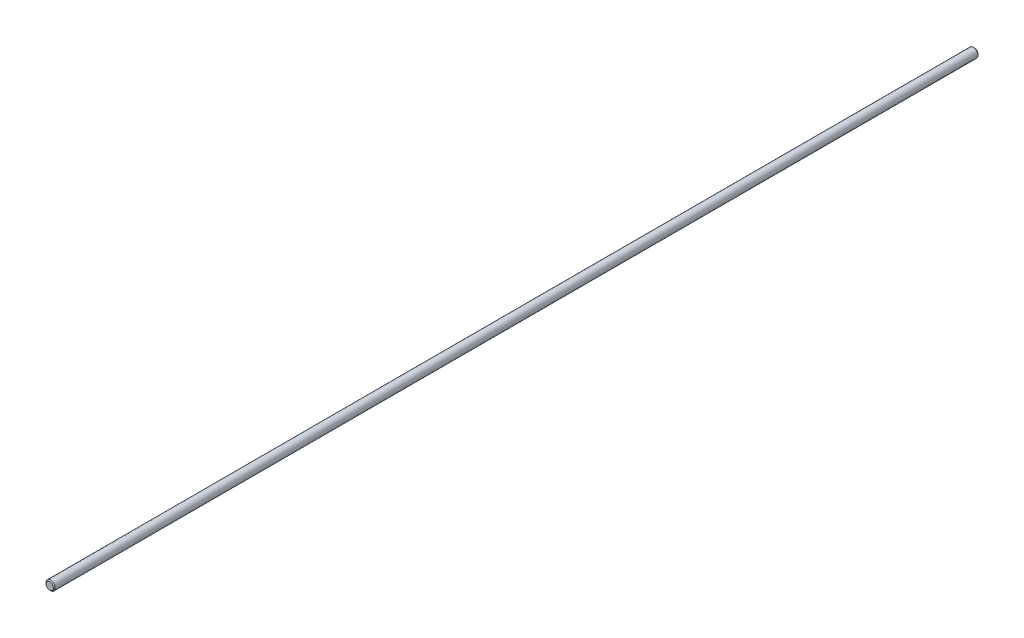
from build123d import *

# Parameters (mm, degrees)
SKETCH1_R           = 2.495
BOSS_EXTRUDE1_DEPTH = 500
CHAMFER1_SIZE       = 0.5


with BuildPart() as part:
    # Sketch1 → Boss-Extrude1 (new body)
    with BuildSketch(Plane.XY):
        Circle(SKETCH1_R)
    extrude(amount=BOSS_EXTRUDE1_DEPTH)

    # Chamfer1
    chamfer1_edges = [part.edges().sort_by_distance(p)[0] for p in [
        (-2.495, 0, 500),
        (-2.495, 0, 0),
    ]]
    chamfer(chamfer1_edges, length=CHAMFER1_SIZE)


solid = part.part
